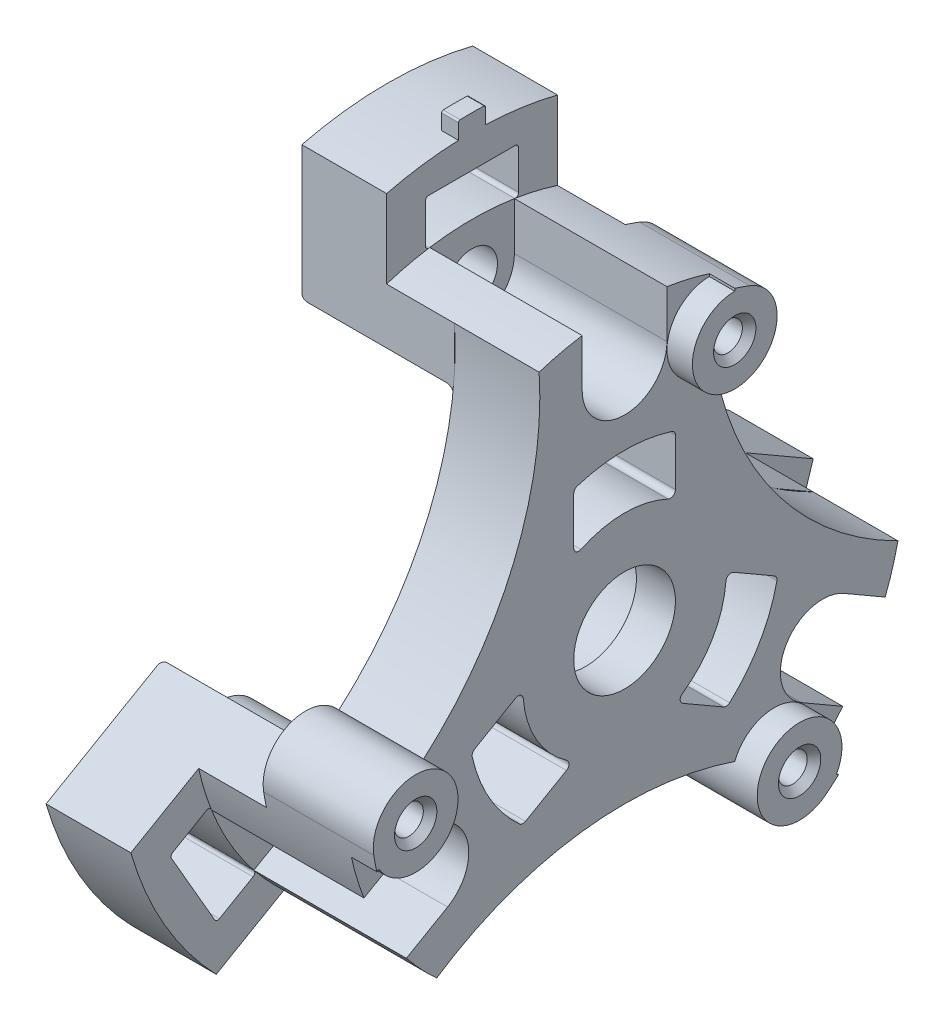
from build123d import *
from build123d.topology import SkipClean

# Parameters (mm, degrees)
SKETCH_2_R                           = 20
CUT_EXTRUDE_1_DEPTH                  = 10
PATTERN_CIRCULAR_1_COUNT             = 3
CUT_EXTRUDE_START                    = -10
CUT_EXTRUDE_2_DEPTH                  = 10
PATTERN_CIRCULAR_2_COUNT             = 3
SKETCH_4_R                           = 1.5
EXTRUDE_1_DEPTH                      = 9
PATTERN_CIRCULAR_3_COUNT             = 3
CUT_EXTRUDE_START_2                  = -1.7
CUT_EXTRUDE_3_DEPTH                  = 1.7
PATTERN_CIRCULAR_4_COUNT             = 3
CUT_EXTRUDE_4_DEPTH                  = 9
PATTERN_CIRCULAR_5_COUNT             = 3
EXTRUDE_START                        = -6.5
EXTRUDE_2_DEPTH                      = 6.5
SKETCH_9_R                           = 0.85
CUT_EXTRUDE_7_DEPTH                  = 6.4
CHAMFER_3_SIZE                       = 0.4
PATTERN_CIRCULAR_8_COUNT             = 3
CHAMFER_3_OF_PATTERN_CIRCULAR_8_SIZE = 0.4
CHAMFER_4_SIZE                       = 0.3
CHAMFER_4_SIZE2                      = 0.519615242
FILLET_6_R                           = 0.5
FILLET_7_R                           = 0.5
EXTRUDE_START_2                      = -5
EXTRUDE_3_DEPTH                      = 5
PATTERN_CIRCULAR_9_COUNT             = 3
EXTRUDE_4_DEPTH                      = 1
FILLET_9_R                           = 0.3
FILLET_10_R                          = 0.2


with BuildPart() as part:
    # 草图1 → 旋转1 (revolve)
    with BuildSketch(Plane.XY, mode=Mode.PRIVATE) as revolve_1_sk:
        Polygon((-7, 6), (-5, 6), (-5, 16.5), (0, 16.5), (0, 3), (-2.3, 3), (-2.3, 3.975), (-7, 3.975), align=None)
    revolve(revolve_1_sk.sketch.rotate(Axis((-65.742857143, 0, 0), (1, 0, 0)), 90), axis=Axis((-65.742857143, 0, 0), (1, 0, 0)))

    # 草图2 → 切除-拉伸1 (cut)
    with BuildSketch(Plane.ZY.offset(5)):
        with Locations((-25, 14.43375673)):
            Circle(SKETCH_2_R)
    cut_extrude_1 = extrude(amount=-CUT_EXTRUDE_1_DEPTH, mode=Mode.SUBTRACT)

    # 阵列(圆周)1: 切除-拉伸1 ×3 about axis
    pattern_circular_1_axis = Axis((0, 0, 0), (1, 0, 0))
    for i in range(1, PATTERN_CIRCULAR_1_COUNT):
        add(cut_extrude_1.rotate(pattern_circular_1_axis, i * 360 / PATTERN_CIRCULAR_1_COUNT), mode=Mode.SUBTRACT)

    # 草图3 → 切除-拉伸2 (cut)
    with BuildSketch(Plane.ZY.offset(5).offset(CUT_EXTRUDE_START)):
        with BuildLine():
            Line((-3, 8.480566019), (-3, 5.692099788))
            ThreePointArc((-3, 5.692099788), (-2.860356745, 5.438553512), (-2.571428571, 5.421047417))
            ThreePointArc((-2.571428571, 5.421047417), (0, 6), (2.571428571, 5.421047417))
            ThreePointArc((2.571428571, 5.421047417), (2.860356745, 5.438553512), (3, 5.692099788))
            Line((3, 5.692099788), (3, 8.480566019))
            ThreePointArc((3, 8.480566019), (2.9421811, 8.657620571), (2.791011236, 8.766427795))
            ThreePointArc((2.791011236, 8.766427795), (0, 9.2), (-2.791011236, 8.766427795))
            ThreePointArc((-2.791011236, 8.766427795), (-2.9421811, 8.657620571), (-3, 8.480566019))
        make_face()
    cut_extrude_2 = extrude(amount=CUT_EXTRUDE_2_DEPTH, mode=Mode.SUBTRACT)

    # 阵列(圆周)2: 切除-拉伸2 ×3 about axis
    pattern_circular_2_axis = Axis((0, 0, 0), (1, 0, 0))
    for i in range(1, PATTERN_CIRCULAR_2_COUNT):
        add(cut_extrude_2.rotate(pattern_circular_2_axis, i * 360 / PATTERN_CIRCULAR_2_COUNT), mode=Mode.SUBTRACT)

    # 草图4 → 凸台-拉伸1 (add)
    with BuildSketch(Plane.ZY.offset(5)):
        with BuildLine():
            Line((-5.040834524, 15.711142139), (-5.040834524, 12.442693129))
            ThreePointArc((-5.040834524, 12.442693129), (-3.92375203, 12.838800373), (-2.776086578, 13.134837963))
            ThreePointArc((-2.776086578, 13.134837963), (0, 10.7), (2.776086578, 13.134837963))
            ThreePointArc((2.776086578, 13.134837963), (3.92375203, 12.838800373), (5.040834524, 12.442693129))
            Line((5.040834524, 12.442693129), (5.040834524, 15.711142139))
            ThreePointArc((5.040834524, 15.711142139), (0, 16.5), (-5.040834524, 15.711142139))
        make_face()
        with Locations((0, 13.5)):
            Circle(SKETCH_4_R, mode=Mode.SUBTRACT)
    extrude_1 = extrude(amount=EXTRUDE_1_DEPTH)

    # 阵列(圆周)3: 凸台-拉伸1 ×3 about axis
    pattern_circular_3_axis = Axis((0, 0, 0), (1, 0, 0))
    for i in range(1, PATTERN_CIRCULAR_3_COUNT):
        add(extrude_1.rotate(pattern_circular_3_axis, i * 360 / PATTERN_CIRCULAR_3_COUNT))

    # 草图5 → 切除-拉伸3 (cut)
    with BuildSketch(Plane.ZY.offset(14).offset(CUT_EXTRUDE_START_2)):
        with BuildLine():
            Line((-2.8, 13.129761041), (-2.8, 9.290818443))
            Line((-2.8, 9.290818443), (2.8, 9.290818443))
            Line((2.8, 9.290818443), (2.8, 13.129761041))
            ThreePointArc((2.8, 13.129761041), (0, 13.425), (-2.8, 13.129761041))
        make_face()
    cut_extrude_3 = extrude(amount=CUT_EXTRUDE_3_DEPTH, mode=Mode.SUBTRACT)

    # 阵列(圆周)4: 切除-拉伸3 ×3 about axis
    pattern_circular_4_axis = Axis((-65.742857143, 0, 0), (-1, 0, 0))
    for i in range(1, PATTERN_CIRCULAR_4_COUNT):
        add(cut_extrude_3.rotate(pattern_circular_4_axis, i * 360 / PATTERN_CIRCULAR_4_COUNT), mode=Mode.SUBTRACT)

    # 草图6 → 切除-拉伸4 (cut)
    with BuildSketch(Plane(origin=(0, 0, 0), x_dir=(0, 0, -1), z_dir=(1, 0, 0))):
        with BuildLine():
            Line((-2.5, 16.30950643), (-2.5, 13.5))
            ThreePointArc((-2.5, 13.5), (0, 11), (2.5, 13.5))
            Line((2.5, 13.5), (2.5, 16.30950643))
            ThreePointArc((2.5, 16.30950643), (0, 16.5), (-2.5, 16.30950643))
        make_face()
    cut_extrude_4 = extrude(amount=-CUT_EXTRUDE_4_DEPTH, mode=Mode.SUBTRACT)

    # 阵列(圆周)5: 切除-拉伸4 ×3 about axis
    pattern_circular_5_axis = Axis((0, 0, 0), (1, 0, 0))
    for i in range(1, PATTERN_CIRCULAR_5_COUNT):
        add(cut_extrude_4.rotate(pattern_circular_5_axis, i * 360 / PATTERN_CIRCULAR_5_COUNT), mode=Mode.SUBTRACT)

    # 草图7 → 凸台-拉伸2 (add)
    with BuildSketch(Plane.ZY.offset(5).offset(EXTRUDE_START)):
        with BuildLine():
            Line((-5, 15.576696831), (-5, 15.724185194))
            ThreePointArc((-5, 15.724185194), (-5.448667451, 15.574402814), (-5.892857143, 15.411821265))
            ThreePointArc((-5.892857143, 15.411821265), (-4.546023726, 10.618261242), (-5, 15.576696831))
        make_face()
    extrude_2 = extrude(amount=EXTRUDE_2_DEPTH)

    # 草图9 → 切除-拉伸7 (cut)
    with SkipClean():  # the faces are left unmerged after this step: merging them gives an invalid solid
        with BuildSketch(Plane(origin=(1.5, 0, 0), x_dir=(0, 0, -1), z_dir=(1, 0, 0))):
            with Locations((5, 13.076696831)):
                Circle(SKETCH_9_R)
        cut_extrude_7 = extrude(amount=-CUT_EXTRUDE_7_DEPTH, mode=Mode.SUBTRACT)

    # 倒角3
    chamfer_3_edges = [part.edges().sort_by_distance(p)[0] for p in [
        (1.5, 13.076696831, -4.15),
    ]]
    chamfer(chamfer_3_edges, length=CHAMFER_3_SIZE)

    # 阵列(圆周)8: 凸台-拉伸2, 切除-拉伸7 ×3 about axis
    with SkipClean():  # the faces are left unmerged after this step: merging them gives an invalid solid
        pattern_circular_8_axis = Axis((0, 0, 0), (1, 0, 0))
        add([extrude_2.rotate(pattern_circular_8_axis, i * 360 / PATTERN_CIRCULAR_8_COUNT) for i in range(1, PATTERN_CIRCULAR_8_COUNT)])
        add([cut_extrude_7.rotate(pattern_circular_8_axis, i * 360 / PATTERN_CIRCULAR_8_COUNT) for i in range(1, PATTERN_CIRCULAR_8_COUNT)], mode=Mode.SUBTRACT)

    # 倒角3 of 阵列(圆周)8
    chamfer_3_of_pattern_circular_8_edges = [part.edges().sort_by_distance(p)[0] for p in [
        (1.5, -2.94434299, 13.399751653),
        (1.5, -10.132353841, -9.249751653),
    ]]
    chamfer(chamfer_3_of_pattern_circular_8_edges, length=CHAMFER_3_OF_PATTERN_CIRCULAR_8_SIZE)

    # 倒角4
    chamfer_4_edges = [part.edges().sort_by_distance(p)[0] for p in [
        (-7, 0, -3.975),
    ]]
    chamfer_4_side = [part.faces().sort_by_distance(p)[0] for p in [
        (-7, 0, -4.144705627),
    ]]
    chamfer(chamfer_4_edges, length=CHAMFER_4_SIZE, length2=CHAMFER_4_SIZE2, reference=chamfer_4_side[0])

    # 圆角6
    # the kernel refuses this fillet: 0.5 mm, written as the material it adds along each edge
    with BuildSketch(Plane(origin=(-5, 0, 0), x_dir=(0, 0.8879046521366066, -0.46002753038722755), z_dir=(0, -0.46002753038722755, -0.8879046521366066))) as fillet_6_piece_1_section:
        with BuildLine():
            CenterArc((13.425 - FILLET_6_R, -FILLET_6_R), FILLET_6_R, 0, 90)
            Line((13.425, -FILLET_6_R), (13.425, 0))
            Line((13.425, 0), (13.425 - FILLET_6_R, 0))
        make_face()
    fillet_6_piece_1 = revolve(axis=Axis((-5, 0, 0), (1, 0, 0)), revolution_arc=20.789711338, mode=Mode.PRIVATE)
    fillet_6_piece_1 = split(fillet_6_piece_1, bisect_by=Plane(origin=(-5.112611265, 12.704959286, -5.040834524), z_dir=(0, 0, 1)), keep=Keep.TOP, mode=Mode.PRIVATE)
    fillet_6_piece_1 = fillet_6_piece_1 - Plane(origin=(-5.112611265, 13.5, 0), x_dir=(0, -0.13041501322751295, -0.9914594920241914), z_dir=(1, 0, 0)) * Cylinder(2.8, 54, mode=Mode.PRIVATE)
    add(fillet_6_piece_1)
    with BuildSketch(Plane(origin=(-5, 13.5, 0), x_dir=(0, 0.3109992794510248, 0.9504101473474194), z_dir=(0, 0.9504101473474194, -0.3109992794510248))) as fillet_6_piece_2:
        with BuildLine():
            CenterArc((2.8 + FILLET_6_R, -FILLET_6_R), FILLET_6_R, 90, 90)
            Line((2.8, -FILLET_6_R), (2.8, 0))
            Line((2.8, 0), (2.8 + FILLET_6_R, 0))
        make_face()
    revolve(axis=Axis((-5, 13.5, 0), (1, 0, 0)), revolution_arc=216.238924047)
    with BuildSketch(Plane(origin=(-5, 0, 0), x_dir=(0, 0.9933744251591909, 0.1149228064382644), z_dir=(0, 0.1149228064382644, -0.9933744251591909))) as fillet_6_piece_3_section:
        with BuildLine():
            CenterArc((13.425 - FILLET_6_R, -FILLET_6_R), FILLET_6_R, 0, 90)
            Line((13.425, -FILLET_6_R), (13.425, 0))
            Line((13.425, 0), (13.425 - FILLET_6_R, 0))
        make_face()
    fillet_6_piece_3 = revolve(axis=Axis((-5, 0, 0), (1, 0, 0)), revolution_arc=20.789711338, mode=Mode.PRIVATE)
    fillet_6_piece_3 = split(fillet_6_piece_3, bisect_by=Plane(origin=(-5.11261127, 12.704959399, 5.040834524), z_dir=(0, 0, -1)), keep=Keep.TOP, mode=Mode.PRIVATE)
    fillet_6_piece_3 = fillet_6_piece_3 - Plane(origin=(-5.11261127, 13.5, 0), x_dir=(0, -0.13041501322751295, -0.9914594920241914), z_dir=(1, 0, 0)) * Cylinder(2.8, 54, mode=Mode.PRIVATE)
    add(fillet_6_piece_3)
    with BuildSketch(Plane(origin=(-5, 0, 0), x_dir=(0, -0.8423478538238606, -0.5389342196950719), z_dir=(0, -0.5389342196950719, 0.8423478538238606))) as fillet_6_piece_4_section:
        with BuildLine():
            CenterArc((13.425 - FILLET_6_R, -FILLET_6_R), FILLET_6_R, 0, 90)
            Line((13.425, -FILLET_6_R), (13.425, 0))
            Line((13.425, 0), (13.425 - FILLET_6_R, 0))
        make_face()
    fillet_6_piece_4 = revolve(axis=Axis((-5, 0, 0), (1, 0, 0)), revolution_arc=20.789711338, mode=Mode.PRIVATE)
    fillet_6_piece_4 = split(fillet_6_piece_4, bisect_by=Plane(origin=(-5.112611265, -10.717970397, -8.482400234), z_dir=(0, 0.8660254037844384, -0.5000000000000004)), keep=Keep.TOP, mode=Mode.PRIVATE)
    fillet_6_piece_4 = fillet_6_piece_4 - Plane(origin=(-5.112611265, -6.75, -11.691342951), x_dir=(0, -0.7934216003024079, 0.608672460502006), z_dir=(1, 0, 0)) * Cylinder(2.8, 54, mode=Mode.PRIVATE)
    add(fillet_6_piece_4)
    with BuildSketch(Plane(origin=(-5, -6.75, -11.691342951), x_dir=(0, 0.6675796918918638, -0.7445383502369533), z_dir=(0, -0.7445383502369533, -0.6675796918918638))) as fillet_6_piece_5:
        with BuildLine():
            CenterArc((2.8 + FILLET_6_R, -FILLET_6_R), FILLET_6_R, 90, 90)
            Line((2.8, -FILLET_6_R), (2.8, 0))
            Line((2.8, 0), (2.8 + FILLET_6_R, 0))
        make_face()
    revolve(axis=Axis((-5, -6.75, -11.691342951), (1, 0, 0)), revolution_arc=216.238924047)
    with BuildSketch(Plane(origin=(-5, 0, 0), x_dir=(0, -0.3971611427298572, -0.917748890876755), z_dir=(0, -0.917748890876755, 0.3971611427298572))) as fillet_6_piece_6_section:
        with BuildLine():
            CenterArc((13.425 - FILLET_6_R, -FILLET_6_R), FILLET_6_R, 0, 90)
            Line((13.425, -FILLET_6_R), (13.425, 0))
            Line((13.425, 0), (13.425 - FILLET_6_R, 0))
        make_face()
    fillet_6_piece_6 = revolve(axis=Axis((-5, 0, 0), (1, 0, 0)), revolution_arc=20.789711338, mode=Mode.PRIVATE)
    fillet_6_piece_6 = split(fillet_6_piece_6, bisect_by=Plane(origin=(-5.11261127, -1.986988946, -13.523234856), z_dir=(0, -0.8660254037844384, 0.5000000000000004)), keep=Keep.TOP, mode=Mode.PRIVATE)
    fillet_6_piece_6 = fillet_6_piece_6 - Plane(origin=(-5.11261127, -6.75, -11.691342951), x_dir=(0, -0.7934216003024079, 0.608672460502006), z_dir=(1, 0, 0)) * Cylinder(2.8, 54, mode=Mode.PRIVATE)
    add(fillet_6_piece_6)
    with BuildSketch(Plane(origin=(-5, 0, 0), x_dir=(0, -0.04555679831274564, 0.9989617500823001), z_dir=(0, 0.9989617500823001, 0.04555679831274564))) as fillet_6_piece_7_section:
        with BuildLine():
            CenterArc((13.425 - FILLET_6_R, -FILLET_6_R), FILLET_6_R, 0, 90)
            Line((13.425, -FILLET_6_R), (13.425, 0))
            Line((13.425, 0), (13.425 - FILLET_6_R, 0))
        make_face()
    fillet_6_piece_7 = revolve(axis=Axis((-5, 0, 0), (1, 0, 0)), revolution_arc=20.789711338, mode=Mode.PRIVATE)
    fillet_6_piece_7 = split(fillet_6_piece_7, bisect_by=Plane(origin=(-5.112611265, -1.986988889, 13.523234758), z_dir=(0, -0.8660254037844388, -0.49999999999999983)), keep=Keep.TOP, mode=Mode.PRIVATE)
    fillet_6_piece_7 = fillet_6_piece_7 - Plane(origin=(-5.112611265, -6.75, 11.691342951), x_dir=(0, 0.9238366135299213, 0.3827870315221857), z_dir=(1, 0, 0)) * Cylinder(2.8, 54, mode=Mode.PRIVATE)
    add(fillet_6_piece_7)
    with BuildSketch(Plane(origin=(-5, -6.75, 11.691342951), x_dir=(0, -0.9785789713428892, -0.20587179711046572), z_dir=(0, -0.20587179711046572, 0.9785789713428892))) as fillet_6_piece_8:
        with BuildLine():
            CenterArc((2.8 + FILLET_6_R, -FILLET_6_R), FILLET_6_R, 90, 90)
            Line((2.8, -FILLET_6_R), (2.8, 0))
            Line((2.8, 0), (2.8 + FILLET_6_R, 0))
        make_face()
    revolve(axis=Axis((-5, -6.75, 11.691342951), (1, 0, 0)), revolution_arc=216.238924047)
    with BuildSketch(Plane(origin=(-5, 0, 0), x_dir=(0, -0.596213282429334, 0.8028260844384911), z_dir=(0, 0.8028260844384911, 0.596213282429334))) as fillet_6_piece_9_section:
        with BuildLine():
            CenterArc((13.425 - FILLET_6_R, -FILLET_6_R), FILLET_6_R, 0, 90)
            Line((13.425, -FILLET_6_R), (13.425, 0))
            Line((13.425, 0), (13.425 - FILLET_6_R, 0))
        make_face()
    fillet_6_piece_9 = revolve(axis=Axis((-5, 0, 0), (1, 0, 0)), revolution_arc=20.789711338, mode=Mode.PRIVATE)
    fillet_6_piece_9 = split(fillet_6_piece_9, bisect_by=Plane(origin=(-5.11261127, -10.717970453, 8.482400332), z_dir=(0, 0.8660254037844388, 0.49999999999999983)), keep=Keep.TOP, mode=Mode.PRIVATE)
    fillet_6_piece_9 = fillet_6_piece_9 - Plane(origin=(-5.11261127, -6.75, 11.691342951), x_dir=(0, 0.9238366135299213, 0.3827870315221857), z_dir=(1, 0, 0)) * Cylinder(2.8, 54, mode=Mode.PRIVATE)
    add(fillet_6_piece_9)

    # 圆角7
    fillet_7_edges = [part.edges().sort_by_distance(p)[0] for p in [
        (-7, 0, -6),
    ]]
    fillet(fillet_7_edges, radius=FILLET_7_R)

    # 草图11 → 凸台-拉伸3 (add)
    with BuildSketch(Plane.ZY.offset(14).offset(EXTRUDE_START_2)):
        with BuildLine():
            Line((-5.040834524, 15.711142139), (-5.040834524, 20.334514681))
            ThreePointArc((-5.040834524, 20.334514681), (-2.539135427, 20.795559413), (0, 20.95))
            ThreePointArc((0, 20.95), (2.539135427, 20.795559413), (5.040834524, 20.334514681))
            Line((5.040834524, 20.334514681), (5.040834524, 15.711142139))
            ThreePointArc((5.040834524, 15.711142139), (3.905398597, 16.031152853), (2.75, 16.269219404))
            Line((2.75, 16.269219404), (2.75, 18.8))
            ThreePointArc((2.75, 18.8), (2.691421356, 18.941421356), (2.55, 19))
            Line((2.55, 19), (-2.55, 19))
            ThreePointArc((-2.55, 19), (-2.691421356, 18.941421356), (-2.75, 18.8))
            Line((-2.75, 18.8), (-2.75, 16.269219404))
            ThreePointArc((-2.75, 16.269219404), (-3.905398597, 16.031152853), (-5.040834524, 15.711142139))
        make_face()
    extrude_3 = extrude(amount=EXTRUDE_3_DEPTH)

    # 阵列(圆周)9: 凸台-拉伸3 ×3 about axis
    pattern_circular_9_axis = Axis((0, 0, 0), (1, 0, 0))
    for i in range(1, PATTERN_CIRCULAR_9_COUNT):
        add(extrude_3.rotate(pattern_circular_9_axis, i * 360 / PATTERN_CIRCULAR_9_COUNT))

    # 草图12 → 凸台-拉伸4 (add)
    with BuildSketch(Plane(origin=(-9, 0, 0), x_dir=(0, 0, -1), z_dir=(1, 0, 0))):
        with BuildLine():
            Line((-0.8, 21.838784307), (-0.8, 20.934719965))
            ThreePointArc((-0.8, 20.934719965), (0, 20.95), (0.8, 20.934719965))
            Line((0.8, 20.934719965), (0.8, 21.838784307))
            ThreePointArc((0.8, 21.838784307), (0.771834414, 21.9083531), (0.703203661, 21.938732976))
            ThreePointArc((0.703203661, 21.938732976), (0, 21.95), (-0.703203661, 21.938732976))
            ThreePointArc((-0.703203661, 21.938732976), (-0.771834414, 21.9083531), (-0.8, 21.838784307))
        make_face()
    extrude(amount=-EXTRUDE_4_DEPTH)

    # 圆角9
    # the kernel refuses this fillet: 0.3 mm, written as the material it takes off along each edge
    with BuildSketch(Plane(origin=(-14, 0, 0), x_dir=(0, 0.9984617910006215, -0.05544413324988807), z_dir=(0, 0.05544413324988807, 0.9984617910006215))) as fillet_9_piece_1:
        with BuildLine():
            CenterArc((13.425 + FILLET_9_R, -FILLET_9_R), FILLET_9_R, 90, 90)
            Line((13.425, -FILLET_9_R), (13.425, 0))
            Line((13.425, 0), (13.425 + FILLET_9_R, 0))
        make_face()
    revolve(axis=Axis((-14, 0, 0), (-1, 0, 0)), revolution_arc=22.076630227, mode=Mode.SUBTRACT)
    with BuildSketch(Plane(origin=(-14, 0, 0), x_dir=(0, 0.9044181039093906, 0.4266472703779351), z_dir=(0, -0.4266472703779351, 0.9044181039093906))) as fillet_9_piece_2:
        with BuildLine():
            CenterArc((13.425 + FILLET_9_R, -FILLET_9_R), FILLET_9_R, 90, 90)
            Line((13.425 + FILLET_9_R, 0), (13.425, 0))
            Line((13.425, 0), (13.425, -FILLET_9_R))
        make_face()
    revolve(axis=Axis((-14, 0, 0), (-1, 0, 0)), revolution_arc=22.076630227, mode=Mode.SUBTRACT)
    with BuildSketch(Plane(origin=(-14, 0, 0), x_dir=(0, -0.5472469233855235, -0.8369712090897028), z_dir=(0, 0.8369712090897028, -0.5472469233855235))) as fillet_9_piece_3:
        with BuildLine():
            CenterArc((13.425 + FILLET_9_R, -FILLET_9_R), FILLET_9_R, 90, 90)
            Line((13.425 + FILLET_9_R, 0), (13.425, 0))
            Line((13.425, 0), (13.425, -FILLET_9_R))
        make_face()
    revolve(axis=Axis((-14, 0, 0), (-1, 0, 0)), revolution_arc=22.076630227, mode=Mode.SUBTRACT)
    with BuildSketch(Plane(origin=(-14, 0, 0), x_dir=(0, -0.08272167735211587, -0.9965726888170537), z_dir=(0, 0.9965726888170537, -0.08272167735211587))) as fillet_9_piece_4:
        with BuildLine():
            CenterArc((13.425 + FILLET_9_R, -FILLET_9_R), FILLET_9_R, 90, 90)
            Line((13.425, -FILLET_9_R), (13.425, 0))
            Line((13.425, 0), (13.425 + FILLET_9_R, 0))
        make_face()
    revolve(axis=Axis((-14, 0, 0), (-1, 0, 0)), revolution_arc=22.076630227, mode=Mode.SUBTRACT)
    with BuildSketch(Plane(origin=(-14, 0, 0), x_dir=(0, -0.4512148676150983, 0.892415342339591), z_dir=(0, -0.892415342339591, -0.4512148676150983))) as fillet_9_piece_5:
        with BuildLine():
            CenterArc((13.425 + FILLET_9_R, -FILLET_9_R), FILLET_9_R, 90, 90)
            Line((13.425, -FILLET_9_R), (13.425, 0))
            Line((13.425, 0), (13.425 + FILLET_9_R, 0))
        make_face()
    revolve(axis=Axis((-14, 0, 0), (-1, 0, 0)), revolution_arc=22.076630227, mode=Mode.SUBTRACT)
    with BuildSketch(Plane(origin=(-14, 0, 0), x_dir=(0, -0.8216964265572749, 0.5699254184391189), z_dir=(0, -0.5699254184391189, -0.8216964265572749))) as fillet_9_piece_6:
        with BuildLine():
            CenterArc((13.425 + FILLET_9_R, -FILLET_9_R), FILLET_9_R, 90, 90)
            Line((13.425 + FILLET_9_R, 0), (13.425, 0))
            Line((13.425, 0), (13.425, -FILLET_9_R))
        make_face()
    revolve(axis=Axis((-14, 0, 0), (-1, 0, 0)), revolution_arc=22.076630227, mode=Mode.SUBTRACT)

    # 圆角10
    fillet_10_edges = [part.edges().sort_by_distance(p)[0] for p in [
        (-11.5, 16.269219404, -2.75),
        (-11.5, 16.269219404, 2.75),
        (-11.5, -10.516179562, -12.714557303),
        (-11.5, -5.753039841, -15.464557303),
        (-11.5, -5.753039841, 15.464557303),
        (-11.5, -10.516179562, 12.714557303),
    ]]
    fillet(fillet_10_edges, radius=FILLET_10_R)


solid = part.part
